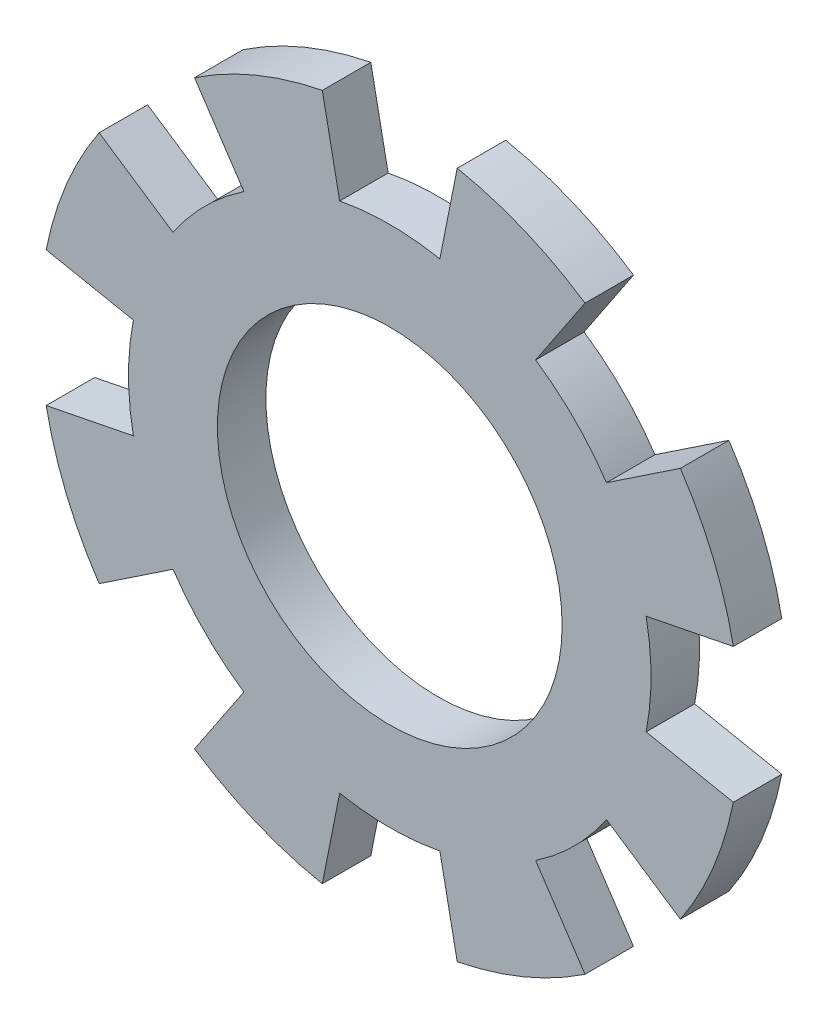
from build123d import *

# Parameters (mm, degrees)
BODYSKE_W      = 1.65
BODYSKE_H      = 0.45
TOOTHCUT_DEPTH = 5.618170633
TOOTHPAT_COUNT = 8


with BuildPart() as part:
    # BodySke → BaseBody (revolve)
    with BuildSketch(Plane(origin=(0, 0, 0), x_dir=(1, 0, 0), z_dir=(0, 1, 0))):
        with Locations((2.425, 0.225)):
            Rectangle(BODYSKE_W, BODYSKE_H)
    revolve(axis=Axis((0, 0, 0), (0, 0, -1)))

    # ToothSke → ToothCut (cut, through all)
    with BuildSketch(Plane.XY):
        with BuildLine():
            Line((-0.465079171, 2.37998453), (-0.638136008, 3.25))
            Line((-0.638136008, 3.25), (0.638136008, 3.25))
            Line((0.638136008, 3.25), (0.465079171, 2.37998453))
            ThreePointArc((0.465079171, 2.37998453), (0, 2.425), (-0.465079171, 2.37998453))
        make_face()
    toothcut = extrude(amount=-TOOTHCUT_DEPTH, mode=Mode.SUBTRACT)

    # ToothPat: ToothCut ×8 about axis
    toothpat_axis = Axis((0, 0, 0), (0, 0, -1))
    for i in range(1, TOOTHPAT_COUNT):
        add(toothcut.rotate(toothpat_axis, i * 360 / TOOTHPAT_COUNT), mode=Mode.SUBTRACT)


solid = part.part
